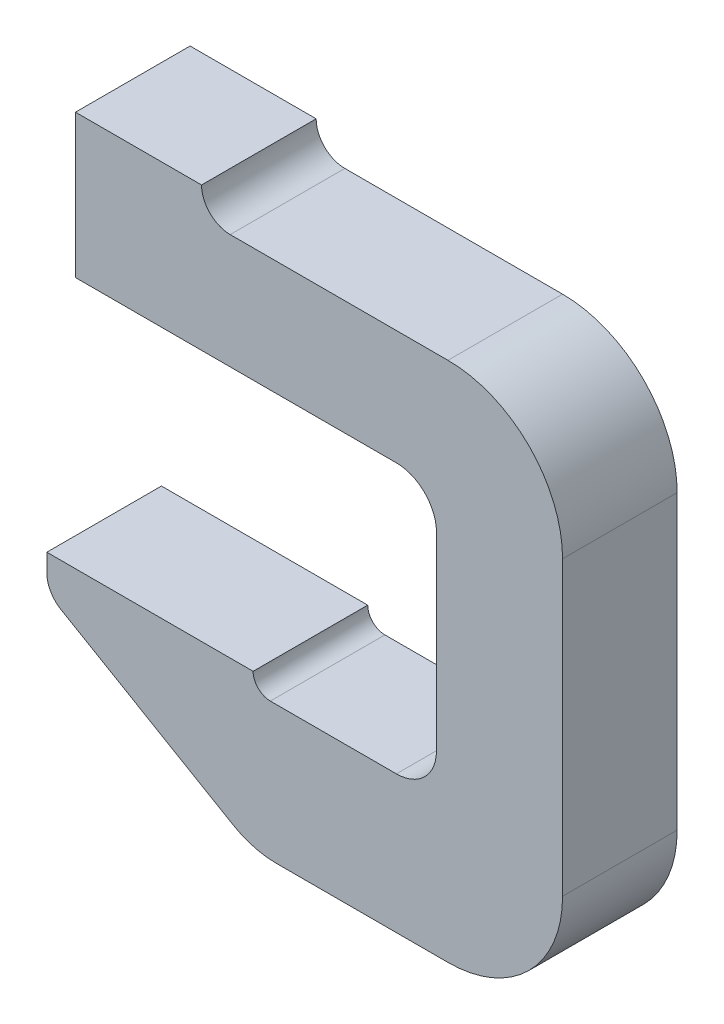
from build123d import *

# Parameters (mm, degrees)
RESSALTO_EXTRUS_O1_DEPTH = 200
FILETE1_R                = 200
FILETE2_R                = 200
FILETE3_R                = 70
FILETE4_R                = 70
FILETE5_R                = 30
FILETE6_R                = 50
FILETE7_R                = 50
FILETE8_R                = 150


with BuildPart() as part:
    # Esboço1 → Ressalto-extrusão1 (new body)
    with BuildSketch(Plane.XY):
        Polygon((0, 0), (0, 910), (-630, 910), (-630, 960), (-850, 960), (-850, 710), (-220, 710), (-220, 240), (-540, 240), (-540, 270), (-900, 270), (-900, 210), (-540, 0), align=None)
    extrude(amount=RESSALTO_EXTRUS_O1_DEPTH)

    # Filete1
    filete1_edges = [part.edges().sort_by_distance(p)[0] for p in [
        (0, 910, 100),
    ]]
    fillet(filete1_edges, radius=FILETE1_R)

    # Filete2
    filete2_edges = [part.edges().sort_by_distance(p)[0] for p in [
        (0, 0, 100),
    ]]
    fillet(filete2_edges, radius=FILETE2_R)

    # Filete3
    filete3_edges = [part.edges().sort_by_distance(p)[0] for p in [
        (-220, 710, 100),
    ]]
    fillet(filete3_edges, radius=FILETE3_R)

    # Filete4
    filete4_edges = [part.edges().sort_by_distance(p)[0] for p in [
        (-220, 240, 100),
    ]]
    fillet(filete4_edges, radius=FILETE4_R)

    # Filete5
    filete5_edges = [part.edges().sort_by_distance(p)[0] for p in [
        (-540, 240, 100),
    ]]
    fillet(filete5_edges, radius=FILETE5_R - 0.0001)  # a hair under: the kernel refuses the full size

    # Filete6
    filete6_edges = [part.edges().sort_by_distance(p)[0] for p in [
        (-630, 910, 100),
    ]]
    fillet(filete6_edges, radius=FILETE6_R - 0.0001)  # a hair under: the kernel refuses the full size

    # Filete7
    filete7_edges = [part.edges().sort_by_distance(p)[0] for p in [
        (-900, 210, 100),
    ]]
    fillet(filete7_edges, radius=FILETE7_R)

    # Filete8
    filete8_edges = [part.edges().sort_by_distance(p)[0] for p in [
        (-540, 0, 100),
    ]]
    fillet(filete8_edges, radius=FILETE8_R)


solid = part.part
